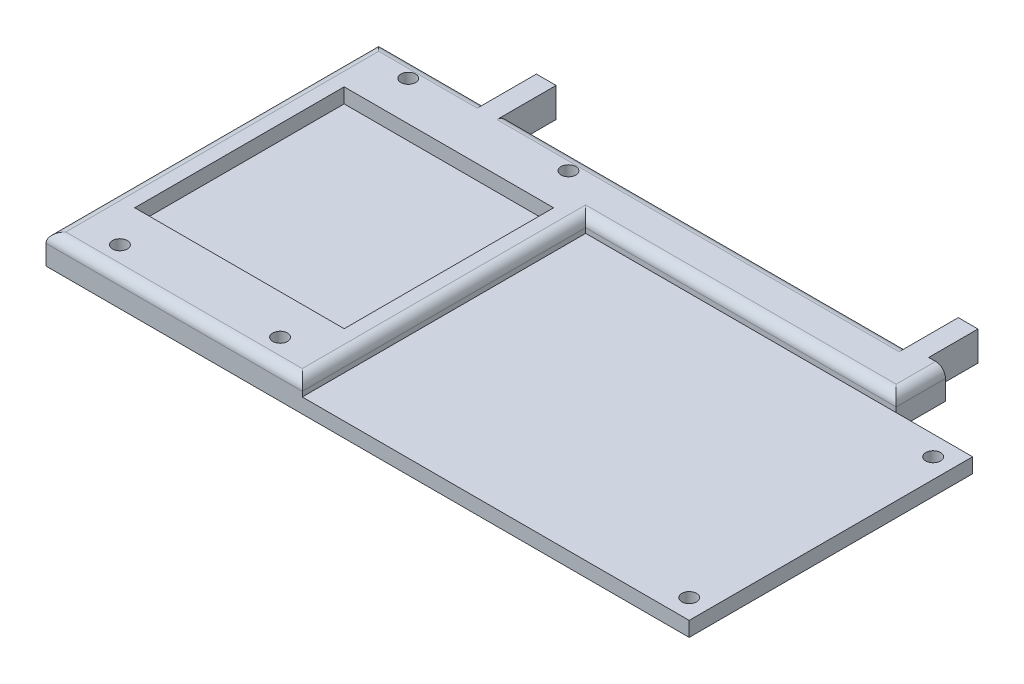
from build123d import *

# Parameters (mm, degrees)
SKETCH1_W                 = 52
SKETCH1_H                 = 66
BOSS_EXTRUDE1_DEPTH       = 6
SKETCH2_W                 = 42.5
SKETCH2_H                 = 42.5
CUT_EXTRUDE1_DEPTH        = 3
SKETCH3_R                 = 1.5
CUT_EXTRUDE2_DEPTH        = 13
SKETCH4_W                 = 10
SKETCH4_H                 = 6
BOSS_EXTRUDE2_DEPTH       = 63
SKETCH5_W                 = 4
SKETCH5_H                 = 6
BOSS_EXTRUDE3_DEPTH       = 10
SKETCH6_R                 = 0.75
CUT_EXTRUDE3_DEPTH        = 114
BOSS_EXTRUDE4_START       = -3
BOSS_EXTRUDE4_OUTLINE_W   = 78.5
BOSS_EXTRUDE4_OUTLINE_H   = 57.5
BOSS_EXTRUDE4_OUTLINE_R   = 1.5
BOSS_EXTRUDE4_DEPTH       = 3
BOSS_EXTRUDE4_START_2     = -30
BOSS_EXTRUDE4_2_OUTLINE_R = 0.75
BOSS_EXTRUDE4_2_DEPTH     = 4
BOSS_EXTRUDE4_START_3     = 55.6
BOSS_EXTRUDE4_3_OUTLINE_R = 0.75
BOSS_EXTRUDE4_3_DEPTH     = 4
SKETCH8_W                 = 52
SKETCH8_H                 = 1.5
BOSS_EXTRUDE5_DEPTH       = 6
FILLET1_R                 = 2


# Read off the part's stored shape, not the designer's step: Boss-Extrude4
with BuildPart() as part:
    # Sketch1 → Boss-Extrude1 (new body)
    with BuildSketch(Plane(origin=(0, 0, 0), x_dir=(1, 0, 0), z_dir=(0, 1, 0))):
        with Locations((-26, -33)):
            Rectangle(SKETCH1_W, SKETCH1_H)
    extrude(amount=BOSS_EXTRUDE1_DEPTH)

    # Sketch2 → Cut-Extrude1 (cut)
    with BuildSketch(Plane(origin=(0, 6, 0), x_dir=(1, 0, 0), z_dir=(0, 1, 0))):
        with Locations((-26, -33)):
            Rectangle(SKETCH2_W, SKETCH2_H)
    extrude(amount=-CUT_EXTRUDE1_DEPTH, mode=Mode.SUBTRACT)

    # Sketch3 → Cut-Extrude2 (cut)
    with BuildSketch(Plane(origin=(0, 6, 0), x_dir=(1, 0, 0), z_dir=(0, 1, 0))):
        with Locations(Location((-42.25, -3.75, 0), (0, 0, 270))):
            Circle(SKETCH3_R)
        with Locations(Location((-9.75, -3.75, 0), (0, 0, 90))):
            Circle(SKETCH3_R)
        with Locations(Location((-9.75, -62.25, 0), (0, 0, 270))):
            Circle(SKETCH3_R)
        with Locations(Location((-42.25, -62.25, 0), (0, 0, 90))):
            Circle(SKETCH3_R)
    extrude(amount=-CUT_EXTRUDE2_DEPTH, mode=Mode.SUBTRACT)

    # Sketch4 → Boss-Extrude2 (add)
    with BuildSketch(Plane(origin=(0, 0, 0), x_dir=(0, 0, -1), z_dir=(1, 0, 0))):
        with Locations((-5, 3)):
            Rectangle(SKETCH4_W, SKETCH4_H)
    extrude(amount=BOSS_EXTRUDE2_DEPTH)

    # Sketch5 → Boss-Extrude3 (add)
    with BuildSketch(Plane(origin=(0, 0, 0), x_dir=(-1, 0, 0), z_dir=(0, 0, -1))):
        with Locations((28, 3)):
            Rectangle(SKETCH5_W, SKETCH5_H)
        with Locations((-57.6, 3)):
            Rectangle(SKETCH5_W, SKETCH5_H)
    extrude(amount=BOSS_EXTRUDE3_DEPTH)

    # Sketch6 → Cut-Extrude3 (cut)
    with BuildSketch(Plane(origin=(59.6, 0, 0), x_dir=(0, 0, -1), z_dir=(1, 0, 0))):
        with Locations((4, 1.5)):
            Circle(SKETCH6_R)
    extrude(amount=-CUT_EXTRUDE3_DEPTH, mode=Mode.SUBTRACT)

    # Boss-Extrude4 outline → Boss-Extrude4 (add)
    with BuildSketch(Plane(origin=(0, 0, 0), x_dir=(-1, 0, 0), z_dir=(0, -1, 0)).offset(BOSS_EXTRUDE4_START)):
        with Locations((-39.25, -38.75)):
            Rectangle(BOSS_EXTRUDE4_OUTLINE_W, BOSS_EXTRUDE4_OUTLINE_H)
        with Locations((-74.5, -63.5)):
            Circle(BOSS_EXTRUDE4_OUTLINE_R, mode=Mode.SUBTRACT)
        with Locations((-74.5, -14)):
            Circle(BOSS_EXTRUDE4_OUTLINE_R, mode=Mode.SUBTRACT)
    extrude(amount=BOSS_EXTRUDE4_DEPTH)

    # Boss-Extrude4 2 outline → Boss-Extrude4 2 (add)
    with BuildSketch(Plane.YZ.offset(BOSS_EXTRUDE4_START_2)):
        with Locations((1.5, -4)):
            Circle(BOSS_EXTRUDE4_2_OUTLINE_R)
    extrude(amount=BOSS_EXTRUDE4_2_DEPTH)

    # Boss-Extrude4 3 outline → Boss-Extrude4 3 (add)
    with BuildSketch(Plane.YZ.offset(BOSS_EXTRUDE4_START_3)):
        with Locations((1.5, -4)):
            Circle(BOSS_EXTRUDE4_3_OUTLINE_R)
    extrude(amount=BOSS_EXTRUDE4_3_DEPTH)

    # Sketch8 → Boss-Extrude5 (add)
    with BuildSketch(Plane(origin=(0, 0, 0), x_dir=(-1, 0, 0), z_dir=(0, -1, 0))):
        with Locations((26, -66.75)):
            Rectangle(SKETCH8_W, SKETCH8_H)
    extrude(amount=-BOSS_EXTRUDE5_DEPTH)

    # Fillet1
    fillet1_edges = [part.edges().sort_by_distance(p)[0] for p in [
        (-52, 6, 33.75),
        (-26, 6, 67.5),
        (0, 6, 38.75),
        (31.5, 6, 10),
        (63, 6, 5),
        (-41, 6, 0),
        (14.8, 6, 0),
    ]]
    fillet(fillet1_edges, radius=FILLET1_R)


solid = part.part
